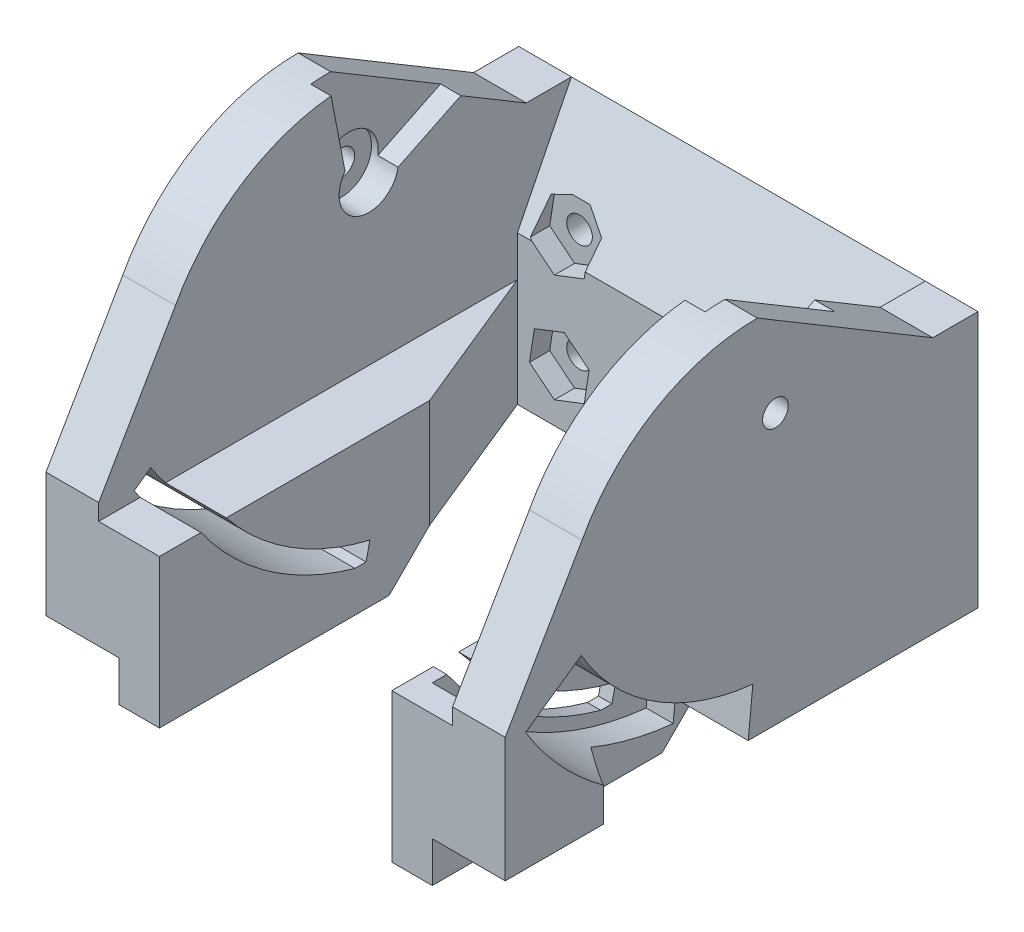
from build123d import *

# Parameters (mm, degrees)
CROQUIS1_W                = 34
CROQUIS1_H                = 19
SALIENTE_EXTRUIR1_DEPTH   = 35
CROQUIS2_W                = 26.2
CROQUIS2_H                = 31
CORTAR_EXTRUIR1_DEPTH     = 25
CORTAR_EXTRUIR3_DEPTH     = 26.2
SALIENTE_EXTRUIR2_DEPTH   = 34
CROQUIS10_W               = 26.2
CROQUIS10_H               = 25.966324345
CORTAR_EXTRUIR4_DEPTH     = 10
CROQUIS18_R               = 0.95
CORTAR_EXTRUIR11_DEPTH    = 4
CORTAR_EXTRUIR12_DEPTH    = 1.5
CORTAR_EXTRUIR14_START    = -34
CROQUIS21_R               = 0.95
CORTAR_EXTRUIR14_DEPTH    = 34
SALIENTE_EXTRUIR3_DEPTH   = 8
CORTAR_EXTRUIR16_START    = -34
CORTAR_EXTRUIR16_DEPTH    = 34
CROQUIS25_W               = 3
CROQUIS25_H               = 20
SALIENTE_EXTRUIR4_DEPTH   = 3
CORTAR_EXTRUIR17_START    = -23.2
CORTAR_EXTRUIR17_DEPTH    = 23.2
CORTAR_EXTRUIR18_DEPTH    = 7.4
CORTAR_EXTRUIR20_START    = -1.5
CORTAR_EXTRUIR20_DEPTH    = 1.5
CORTAR_EXTRUIR21_DEPTH    = 27.7
CORTAR_EXTRUIR22_START    = -34
CORTAR_EXTRUIR22_DEPTH    = 34
CROQUIS33_W               = 5.4
CROQUIS33_H               = 0.827388273
SALIENTE_EXTRUIR5_DEPTH   = 0.2
SALIENTE_EXTRUIR6_START   = -5.4
SALIENTE_EXTRUIR6_DEPTH   = 5.4
SALIENTE_EXTRUIR6_2_DEPTH = 5.4
CORTAR_EXTRUIR23_DEPTH    = 3
CROQUIS36_R               = 2.2
CORTAR_EXTRUIR24_DEPTH    = 2
CORTAR_EXTRUIR25_START    = 28.2
CROQUIS36_2_R             = 2.2
CORTAR_EXTRUIR25_DEPTH    = 28.2
CORTAR_EXTRUIR26_START    = -34
CORTAR_EXTRUIR26_DEPTH    = 34
CORTAR_EXTRUIR27_DEPTH    = 1


# Read off the part's stored shape, not the designer's step: Saliente-Extruir6
with BuildPart() as part:
    # Croquis1 → Saliente-Extruir1 (new body)
    with BuildSketch(Plane.XY):
        with Locations((-31.887263086, 5.12254902)):
            Rectangle(CROQUIS1_W, CROQUIS1_H)
    extrude(amount=SALIENTE_EXTRUIR1_DEPTH)

    # Croquis2 → Cortar-Extruir1 (cut)
    with BuildSketch(Plane.XZ.offset(4.37745098)):
        with Locations((-31.887263086, 19.5)):
            Rectangle(CROQUIS2_W, CROQUIS2_H)
    extrude(amount=-CORTAR_EXTRUIR1_DEPTH, mode=Mode.SUBTRACT)

    # Croquis4 → Cortar-Extruir3 (cut)
    with BuildSketch(Plane.ZY.offset(18.787263086)):
        Polygon((4, 14.62254902), (4, 6.62254902), (0, 14.62254902), align=None)
    extrude(amount=CORTAR_EXTRUIR3_DEPTH, mode=Mode.SUBTRACT)

    # Croquis9 → Saliente-Extruir2 (add)
    with BuildSketch(Plane(origin=(-14.887263086, 0, 0), x_dir=(0, 0, -1), z_dir=(1, 0, 0))):
        with BuildLine():
            Line((-29.315831827, 14.62254902), (-3.349507482, 14.62254902))
            ThreePointArc((-3.349507482, 14.62254902), (-16.332669655, 22.37254902), (-29.315831827, 14.62254902))
        make_face()
    extrude(amount=-SALIENTE_EXTRUIR2_DEPTH)

    # Croquis10 → Cortar-Extruir4 (cut)
    with BuildSketch(Plane.XZ.offset(-14.62254902)):
        with Locations((-31.887263086, 16.332669655)):
            Rectangle(CROQUIS10_W, CROQUIS10_H)
    extrude(amount=-CORTAR_EXTRUIR4_DEPTH, mode=Mode.SUBTRACT)

    # Croquis18 → Cortar-Extruir11 (cut)
    with BuildSketch(Plane(origin=(0, 0, 0), x_dir=(-1, 0, 0), z_dir=(0, 0, -1))):
        with Locations((41.887263086, -0.37745098)):
            Circle(CROQUIS18_R)
        with Locations((21.887263086, -0.37745098)):
            Circle(CROQUIS18_R)
        with Locations((21.887263086, 7.62254902)):
            Circle(CROQUIS18_R)
        with Locations((41.887263086, 7.62254902)):
            Circle(CROQUIS18_R)
    extrude(amount=-CORTAR_EXTRUIR11_DEPTH, mode=Mode.SUBTRACT)

    # Croquis19 → Cortar-Extruir12 (cut)
    with BuildSketch(Plane.XY.offset(4)):
        Polygon((-43.731270866, 1.106789108), (-44.094656598, -1.232288518), (-42.250648818, -2.716528607), (-40.043255306, -1.861691069), (-39.679869573, 0.477386558), (-41.523877353, 1.961626646), align=None)
        Polygon((-23.731270866, 1.106789108), (-24.094656598, -1.232288518), (-22.250648818, -2.716528607), (-20.043255306, -1.861691069), (-19.679869573, 0.477386558), (-21.523877353, 1.961626646), align=None)
        Polygon((-43.731270866, 9.106789108), (-44.094656598, 6.767711482), (-42.250648818, 5.283471393), (-40.043255306, 6.138308931), (-39.679869573, 8.477386558), (-41.523877353, 9.961626646), align=None)
        Polygon((-23.731270866, 9.106789108), (-24.094656598, 6.767711482), (-22.250648818, 5.283471393), (-20.043255306, 6.138308931), (-19.679869573, 8.477386558), (-21.523877353, 9.961626646), align=None)
    extrude(amount=-CORTAR_EXTRUIR12_DEPTH, mode=Mode.SUBTRACT)

    # Croquis21 → Cortar-Extruir14 (cut)
    with BuildSketch(Plane(origin=(-14.887263086, 0, 0), x_dir=(0, 0, -1), z_dir=(1, 0, 0)).offset(CORTAR_EXTRUIR14_START)):
        with Locations((-15, 15.62254902)):
            Circle(CROQUIS21_R)
    extrude(amount=CORTAR_EXTRUIR14_DEPTH, mode=Mode.SUBTRACT)

    # Croquis23 → Saliente-Extruir3 (add)
    with BuildSketch(Plane.XZ.offset(4.37745098)):
        Polygon((-44.987263086, 35), (-40.487263086, 35), (-40.487263086, 15), (-44.987263086, 4), align=None)
        Polygon((-18.787263086, 35), (-23.287263086, 35), (-23.287263086, 15), (-18.787263086, 4), align=None)
    extrude(amount=-SALIENTE_EXTRUIR3_DEPTH)

    # Croquis24 → Cortar-Extruir16 (cut)
    with BuildSketch(Plane(origin=(-14.887263086, 0, 0), x_dir=(0, 0, -1), z_dir=(1, 0, 0)).offset(CORTAR_EXTRUIR16_START)):
        with BuildLine():
            Line((-19.423271375, -3.112369457), (-19.744087704, -4.577660174))
            ThreePointArc((-19.744087704, -4.577660174), (-26.911270078, -1.367932572), (-32.372332418, 4.275439874))
            Line((-32.372332418, 4.275439874), (-31.142668885, 5.135569413))
            ThreePointArc((-31.142668885, 5.135569413), (-26.079106399, -0.119620507), (-19.423271375, -3.112369457))
        make_face()
    extrude(amount=CORTAR_EXTRUIR16_DEPTH, mode=Mode.SUBTRACT)

    # Croquis25 → Saliente-Extruir4 (add)
    with BuildSketch(Plane.XZ.offset(4.37745098)):
        with Locations((-21.787263086, 25)):
            Rectangle(CROQUIS25_W, CROQUIS25_H)
        with Locations((-41.987263086, 25)):
            Rectangle(CROQUIS25_W, CROQUIS25_H)
    extrude(amount=SALIENTE_EXTRUIR4_DEPTH)

    # Croquis26 → Cortar-Extruir17 (cut)
    with BuildSketch(Plane(origin=(-20.287263086, 0, 0), x_dir=(0, 0, -1), z_dir=(1, 0, 0)).offset(CORTAR_EXTRUIR17_START)):
        Polygon((-18, -7.37745098), (-15, -7.37745098), (-15, -4.37745098), align=None)
    extrude(amount=CORTAR_EXTRUIR17_DEPTH, mode=Mode.SUBTRACT)

    # Croquis27 → Cortar-Extruir18 (cut)
    with BuildSketch(Plane(origin=(-14.887263086, 0, 0), x_dir=(0, 0, -1), z_dir=(1, 0, 0))):
        with BuildLine():
            Line((-16.665899018, -0.922309645), (-17.167910976, -5.908036155))
            ThreePointArc((-17.167910976, -5.908036155), (-26.540732538, -2.68257126), (-33.492032026, 4.383746258))
            Line((-33.492032026, 4.383746258), (-29.371216121, 7.25740019))
            ThreePointArc((-29.371216121, 7.25740019), (-24.001343163, 1.641011586), (-16.665899018, -0.922309645))
        make_face()
    extrude(amount=-CORTAR_EXTRUIR18_DEPTH, mode=Mode.SUBTRACT)

    # Croquis29 → Cortar-Extruir20 (cut)
    with BuildSketch(Plane.ZY.offset(18.787263086).offset(CORTAR_EXTRUIR20_START)):
        with BuildLine():
            Line((17.797402962, 22.299641931), (16.5, 15.62254902))
            ThreePointArc((16.5, 15.62254902), (15.426958984, 14.184596995), (13.743058632, 14.803953638))
            Line((13.743058632, 14.803953638), (6.296886003, 18.432060872))
            ThreePointArc((6.296886003, 18.432060872), (11.631045274, 21.603150873), (17.797402962, 22.299641931))
        make_face()
    extrude(amount=CORTAR_EXTRUIR20_DEPTH, mode=Mode.SUBTRACT)

    # Croquis29<2> → Cortar-Extruir21 (cut)
    with BuildSketch(Plane.ZY.offset(18.787263086)):
        with BuildLine():
            Line((17.797402962, 22.299641931), (16.5, 15.62254902))
            ThreePointArc((16.5, 15.62254902), (15.426958984, 14.184596995), (13.743058632, 14.803953638))
            Line((13.743058632, 14.803953638), (6.296886003, 18.432060872))
            ThreePointArc((6.296886003, 18.432060872), (11.631045274, 21.603150873), (17.797402962, 22.299641931))
        make_face()
    extrude(amount=CORTAR_EXTRUIR21_DEPTH, mode=Mode.SUBTRACT)

    # Croquis30 → Cortar-Extruir22 (cut)
    with BuildSketch(Plane.ZY.offset(48.887263086).offset(CORTAR_EXTRUIR22_START)):
        Polygon((29.315831827, 14.62254902), (35, 4.827802707), (35, 14.62254902), align=None)
    extrude(amount=CORTAR_EXTRUIR22_DEPTH, mode=Mode.SUBTRACT)

    # Saliente-Extruir6 2 outline → Saliente-Extruir6 2 (add)
    with BuildSketch(Plane.ZY.offset(48.887263086).offset(SALIENTE_EXTRUIR6_START)):
        Polygon((19.700253141, -4.37745098), (19.700253141, -4.17745098), (19.656464379, -4.17745098), align=None)
    extrude(amount=SALIENTE_EXTRUIR6_2_DEPTH)

    # Croquis35 → Cortar-Extruir23 (cut)
    with BuildSketch(Plane.XZ.offset(4.37745098)):
        Polygon((-20.287263086, 23.262320252), (-14.887263086, 27.727784977), (-14.887263086, 23.262320252), align=None)
    extrude(amount=-CORTAR_EXTRUIR23_DEPTH, mode=Mode.SUBTRACT)

    # Croquis36 → Cortar-Extruir24 (cut)
    with BuildSketch(Plane.ZY.offset(18.787263086)):
        with Locations((15, 15.62254902)):
            Circle(CROQUIS36_R)
    extrude(amount=-CORTAR_EXTRUIR24_DEPTH, mode=Mode.SUBTRACT)

    # Croquis36<2> → Cortar-Extruir25 (cut)
    with BuildSketch(Plane.ZY.offset(18.787263086).offset(CORTAR_EXTRUIR25_START)):
        with Locations((15, 15.62254902)):
            Circle(CROQUIS36_2_R)
    extrude(amount=-CORTAR_EXTRUIR25_DEPTH, mode=Mode.SUBTRACT)

    # Croquis38 → Cortar-Extruir26 (cut)
    with BuildSketch(Plane.ZY.offset(48.887263086).offset(CORTAR_EXTRUIR26_START)):
        Polygon((3.349507482, 14.62254902), (16.332669655, 22.37254902), (3.349507482, 22.37254902), align=None)
    extrude(amount=CORTAR_EXTRUIR26_DEPTH, mode=Mode.SUBTRACT)

    # Croquis40 → Cortar-Extruir27 (cut)
    with BuildSketch(Plane.ZY.offset(48.887263086)):
        Polygon((24.462469518, 4.967906508), (27.804965088, 0.984475403), (27.192129534, 0.470245316), (23.849633963, 4.45367642), align=None)
        Polygon((23.499956861, 4.180731289), (26.48255433, -0.078859342), (25.827232695, -0.537720491), (22.844635226, 3.72187014), align=None)
        Polygon((22.469633136, 3.484764914), (25.069633136, -1.018567186), (24.376812813, -1.418567186), (21.776812813, 3.084764914), align=None)
        Polygon((21.381853505, 2.883100647), (23.579468466, -1.829699846), (22.854422236, -2.167794455), (20.656807275, 2.545006037), align=None)
    extrude(amount=-CORTAR_EXTRUIR27_DEPTH, mode=Mode.SUBTRACT)


with BuildPart() as body_2:
    # Croquis33 → Saliente-Extruir5 (new body)
    with BuildSketch(Plane.XZ.offset(4.37745098)):
        with Locations((-46.187263086, 20.113947278)):
            Rectangle(CROQUIS33_W, CROQUIS33_H)
    extrude(amount=-SALIENTE_EXTRUIR5_DEPTH)

    # Saliente-Extruir6 outline → Saliente-Extruir6 (add)
    with BuildSketch(Plane.ZY.offset(48.887263086).offset(SALIENTE_EXTRUIR6_START)):
        Polygon((21.135776638, -4.17745098), (20.527641414, -4.17745098), (20.527641414, -4.37745098), align=None)
    extrude(amount=SALIENTE_EXTRUIR6_DEPTH)


solid = Compound([part.part, body_2.part])
